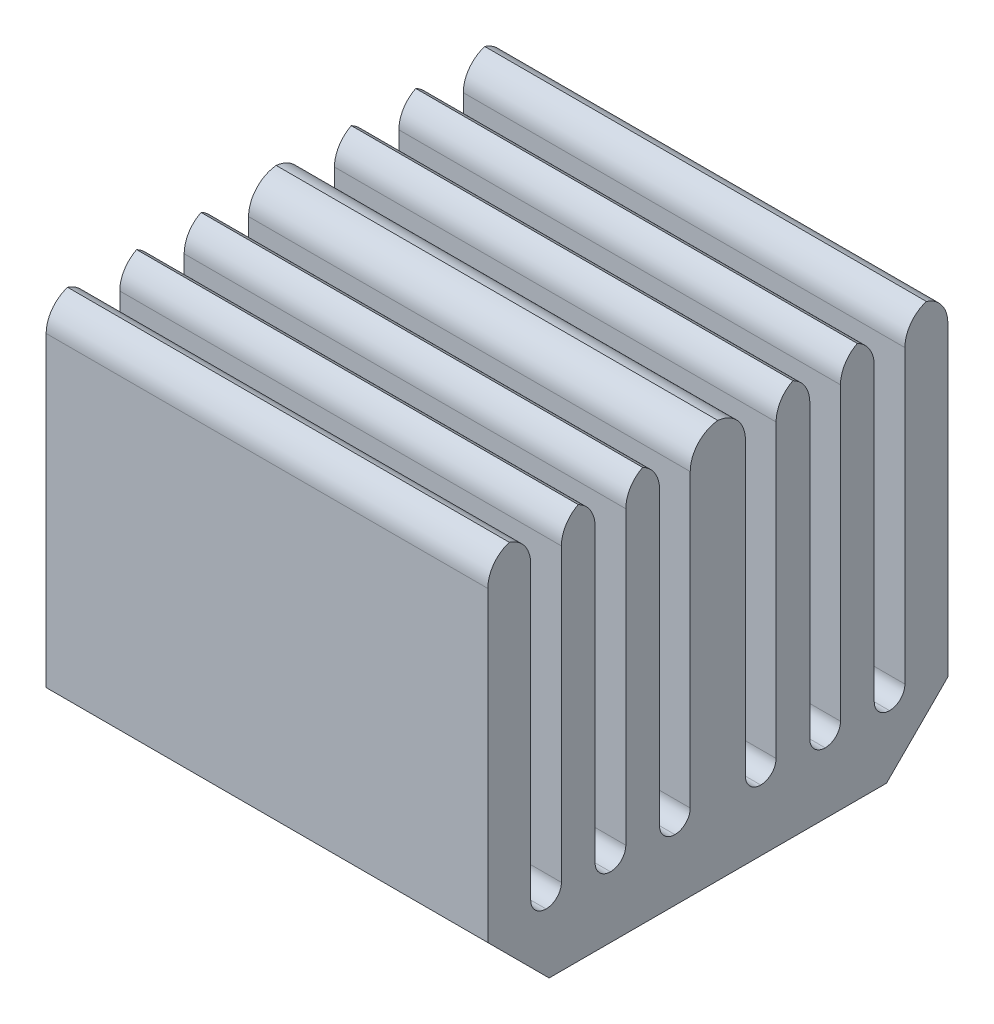
from build123d import *

# Parameters (mm, degrees)
SKIZZE1_W                       = 14.4
SKIZZE1_H                       = 15
AUFSATZ_LINEAR_AUSTRAGEN1_DEPTH = 13
SKIZZE2_W                       = 14.4
SKIZZE2_H                       = 1
SCHNITT_LINEAR_AUSTRAGEN1_DEPTH = 11
VERRUNDUNG1_R                   = 1
FASE1_SIZE                      = 2
VERRUNDUNG3_R                   = 0.5


# Some blends are built 0.0001 mm under size
with BuildPart() as part:
    # Skizze1 → Aufsatz-Linear austragen1 (new body)
    with BuildSketch(Plane(origin=(0, 0, 0), x_dir=(1, 0, 0), z_dir=(0, 1, 0))):
        Rectangle(SKIZZE1_W, SKIZZE1_H)
    extrude(amount=AUFSATZ_LINEAR_AUSTRAGEN1_DEPTH)

    # Skizze2 → Schnitt-Linear austragen1 (cut)
    with BuildSketch(Plane(origin=(0, 13, 0), x_dir=(1, 0, 0), z_dir=(0, 1, 0))):
        with Locations((0, -5.6)):
            Rectangle(SKIZZE2_W, SKIZZE2_H)
        with Locations((0, -3.5)):
            Rectangle(SKIZZE2_W, SKIZZE2_H)
        with Locations((0, -1.4)):
            Rectangle(SKIZZE2_W, SKIZZE2_H)
        with Locations((0, 1.4)):
            Rectangle(SKIZZE2_W, SKIZZE2_H)
        with Locations((0, 3.5)):
            Rectangle(SKIZZE2_W, SKIZZE2_H)
        with Locations((0, 5.6)):
            Rectangle(SKIZZE2_W, SKIZZE2_H)
    extrude(amount=-SCHNITT_LINEAR_AUSTRAGEN1_DEPTH, mode=Mode.SUBTRACT)

    # Verrundung1
    # the kernel refuses this fillet: 1 mm, written as the material it takes off along each edge
    with BuildSketch(Plane(origin=(-9.7, 13, 7.5), x_dir=(0, -1, 0), z_dir=(1, 0, 0)), Plane(origin=(-9.7, 13, 6.1), x_dir=(0, 0, 1), z_dir=(1, 0, 0)), Plane(origin=(-9.7, 13, 3), x_dir=(0, -1, 0), z_dir=(1, 0, 0)), Plane(origin=(-9.7, 13, 0.9), x_dir=(0, -1, 0), z_dir=(1, 0, 0)), Plane(origin=(-9.7, 13, -1.9), x_dir=(0, -1, 0), z_dir=(1, 0, 0)), Plane(origin=(-9.7, 13, -4), x_dir=(0, -1, 0), z_dir=(1, 0, 0)), Plane(origin=(-9.7, 13, -6.1), x_dir=(0, -1, 0), z_dir=(1, 0, 0))) as verrundung1_piece_1:
        with BuildLine():
            CenterArc((VERRUNDUNG1_R, VERRUNDUNG1_R), VERRUNDUNG1_R, 180, 90)
            Line((0, VERRUNDUNG1_R), (0, 0))
            Line((0, 0), (VERRUNDUNG1_R, 0))
        make_face()
    extrude(amount=19.4, mode=Mode.SUBTRACT)
    with BuildSketch(Plane(origin=(9.7, 13, 5.1), x_dir=(0, -1, 0), z_dir=(-1, 0, 0)), Plane(origin=(9.7, 13, 4), x_dir=(0, 0, 1), z_dir=(-1, 0, 0)), Plane(origin=(9.7, 13, 1.9), x_dir=(0, 0, 1), z_dir=(-1, 0, 0)), Plane(origin=(9.7, 13, -0.9), x_dir=(0, 0, 1), z_dir=(-1, 0, 0)), Plane(origin=(9.7, 13, -3), x_dir=(0, 0, 1), z_dir=(-1, 0, 0)), Plane(origin=(9.7, 13, -5.1), x_dir=(0, 0, 1), z_dir=(-1, 0, 0)), Plane(origin=(9.7, 13, -7.5), x_dir=(0, 0, 1), z_dir=(-1, 0, 0))) as verrundung1_piece_2:
        with BuildLine():
            CenterArc((VERRUNDUNG1_R, -VERRUNDUNG1_R), VERRUNDUNG1_R, 90, 90)
            Line((0, -VERRUNDUNG1_R), (0, 0))
            Line((0, 0), (VERRUNDUNG1_R, 0))
        make_face()
    extrude(amount=19.4, mode=Mode.SUBTRACT)

    # Fase1
    fase1_edges = [part.edges().sort_by_distance(p)[0] for p in [
        (0, 0, 7.5),
        (0, 0, -7.5),
    ]]
    chamfer(fase1_edges, length=FASE1_SIZE)

    # Verrundung3
    verrundung3_edges = [part.edges().sort_by_distance(p)[0] for p in [
        (0, 2, -5.1),
        (0, 2, -3),
        (0, 2, -0.9),
        (0, 2, 1.9),
        (0, 2, 4),
        (0, 2, 6.1),
        (0, 2, 5.1),
        (0, 2, 3),
        (0, 2, 0.9),
        (0, 2, -1.9),
        (0, 2, -4),
        (0, 2, -6.1),
    ]]
    fillet(verrundung3_edges, radius=VERRUNDUNG3_R - 0.0001)  # a hair under: the kernel refuses the full size


solid = part.part
